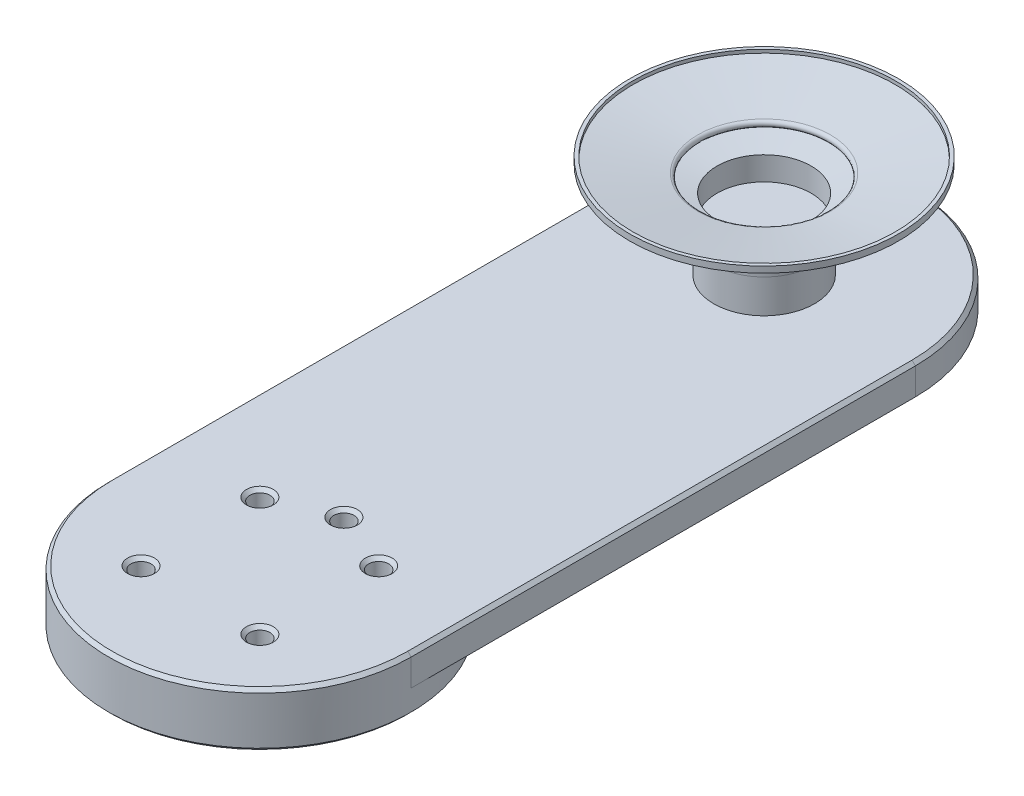
from build123d import *

# Parameters (mm, degrees)
SKIZZE2_R                       = 45
SKIZZE2_R_2                     = 31.5
AUFSATZ_LINEAR_AUSTRAGEN1_DEPTH = 6.2
SKIZZE3_R                       = 3
SKIZZE3_R_2                     = 6
AUFSATZ_LINEAR_AUSTRAGEN2_DEPTH = 10
SKIZZE4_R                       = 15
SKIZZE4_R_2                     = 6
AUFSATZ_LINEAR_AUSTRAGEN3_DEPTH = 10
SKIZZE5_R                       = 15
SKIZZE5_R_2                     = 6
AUFSATZ_LINEAR_AUSTRAGEN4_DEPTH = 3
VERRUNDUNG1_R                   = 1
FASE1_SIZE                      = 1


with BuildPart() as part:
    # Skizze2 → Aufsatz-Linear austragen1 (new body)
    with BuildSketch(Plane(origin=(0, 0, 0), x_dir=(1, 0, 0), z_dir=(0, 1, 0))):
        with Locations(Location((0, 0, 0), (0, 0, 90))):
            Circle(SKIZZE2_R)
        with Locations(Location((0, 0, 0), (0, 0, 90))):
            Circle(SKIZZE2_R_2, mode=Mode.SUBTRACT)
    extrude(amount=AUFSATZ_LINEAR_AUSTRAGEN1_DEPTH)

    # Skizze3 → Aufsatz-Linear austragen2 (add)
    with BuildSketch(Plane(origin=(0, 6.2, 0), x_dir=(1, 0, 0), z_dir=(0, 1, 0))):
        with BuildLine():
            Line((-45, 0), (-45, 150))
            ThreePointArc((-45, 150), (0, 195), (45, 150))
            Line((45, 150), (45, 0))
            ThreePointArc((45, 0), (0, -45), (-45, 0))
        make_face()
        with Locations(Location((0, 25, 0), (0, 0, 270))):
            Circle(SKIZZE3_R, mode=Mode.SUBTRACT)
        with Locations(Location((17.67766953, 17.67766953, 0), (0, 0, 270))):
            Circle(SKIZZE3_R, mode=Mode.SUBTRACT)
        with Locations(Location((17.67766953, -17.67766953, 0), (0, 0, 270))):
            Circle(SKIZZE3_R, mode=Mode.SUBTRACT)
        with Locations(Location((-17.67766953, -17.67766953, 0), (0, 0, 270))):
            Circle(SKIZZE3_R, mode=Mode.SUBTRACT)
        with Locations(Location((-17.67766953, 17.67766953, 0), (0, 0, 270))):
            Circle(SKIZZE3_R, mode=Mode.SUBTRACT)
        with Locations(Location((0, 150, 0), (0, 0, 270))):
            Circle(SKIZZE3_R_2, mode=Mode.SUBTRACT)
    extrude(amount=AUFSATZ_LINEAR_AUSTRAGEN2_DEPTH)

    # Fase1
    # the kernel refuses this chamfer: 1 mm, written as the material it takes off along each edge
    with BuildSketch(Plane(origin=(0, 16.2, 0), x_dir=(1, 0, 0), z_dir=(0, 0, -1))) as fase1_piece_1:
        Polygon((45, FASE1_SIZE), (45 - FASE1_SIZE, 0), (45, 0), align=None)
    revolve(axis=Axis((0, 16.2, 0), (0, -1, 0)), revolution_arc=180, mode=Mode.SUBTRACT)
    with BuildSketch(Plane(origin=(45, 16.2, -150), x_dir=(0.0274958766105891, -0.9996219169112968, 0), z_dir=(0, 0, 1)), Plane(origin=(-45, 16.2, 0), x_dir=(-0.0274958766105891, -0.9996219169112968, 0), z_dir=(0, 0, -1))) as fase1_piece_2:
        Polygon((FASE1_SIZE * 0.999621916911, -FASE1_SIZE * 0.0274958766106), (-FASE1_SIZE * 0.0274958766106, -FASE1_SIZE * 0.999621916911), (0, 0), align=None)
    extrude(amount=150, mode=Mode.SUBTRACT)
    with BuildSketch(Plane(origin=(0, 16.2, -150), x_dir=(-1, 0, 0), z_dir=(0, 0, 1))) as fase1_piece_3:
        Polygon((45, FASE1_SIZE), (45 - FASE1_SIZE, 0), (45, 0), align=None)
    revolve(axis=Axis((0, 16.2, -150), (0, -1, 0)), revolution_arc=180, mode=Mode.SUBTRACT)
    with BuildSketch(Plane(origin=(0, 6.2, -25), x_dir=(0, 0, 1), z_dir=(-1, 0, 0))) as fase1_piece_4:
        Polygon((3 + FASE1_SIZE, 0), (3, FASE1_SIZE), (3, 0), align=None)
    revolve(axis=Axis((0, 6.2, -25), (0, 1, 0)), mode=Mode.SUBTRACT)
    with BuildSketch(Plane(origin=(17.67766953, 6.2, -17.67766953), x_dir=(0, 0, 1), z_dir=(-1, 0, 0))) as fase1_piece_5:
        Polygon((3 + FASE1_SIZE, 0), (3, FASE1_SIZE), (3, 0), align=None)
    revolve(axis=Axis((17.67766953, 6.2, -17.67766953), (0, 1, 0)), mode=Mode.SUBTRACT)
    with BuildSketch(Plane(origin=(17.67766953, 6.2, 17.67766953), x_dir=(0, 0, 1), z_dir=(-1, 0, 0))) as fase1_piece_6:
        Polygon((3 + FASE1_SIZE, 0), (3, FASE1_SIZE), (3, 0), align=None)
    revolve(axis=Axis((17.67766953, 6.2, 17.67766953), (0, 1, 0)), mode=Mode.SUBTRACT)
    with BuildSketch(Plane(origin=(-17.67766953, 6.2, 17.67766953), x_dir=(0, 0, 1), z_dir=(-1, 0, 0))) as fase1_piece_7:
        Polygon((3 + FASE1_SIZE, 0), (3, FASE1_SIZE), (3, 0), align=None)
    revolve(axis=Axis((-17.67766953, 6.2, 17.67766953), (0, 1, 0)), mode=Mode.SUBTRACT)
    with BuildSketch(Plane(origin=(-17.67766953, 6.2, -17.67766953), x_dir=(0, 0, 1), z_dir=(-1, 0, 0))) as fase1_piece_8:
        Polygon((3 + FASE1_SIZE, 0), (3, FASE1_SIZE), (3, 0), align=None)
    revolve(axis=Axis((-17.67766953, 6.2, -17.67766953), (0, 1, 0)), mode=Mode.SUBTRACT)
    with BuildSketch(Plane(origin=(45, 6.2, -150), x_dir=(-0.9996219169112968, -0.027495876610586414, 0), z_dir=(0, 0, 1))) as fase1_piece_9_section:
        Polygon((FASE1_SIZE * 0.999621916911, -FASE1_SIZE * 0.0274958766106), (-FASE1_SIZE * 0.0274958766106, -FASE1_SIZE * 0.999621916911), (0, 0), align=None)
    fase1_piece_9 = extrude(amount=152.571682988, mode=Mode.PRIVATE)
    fase1_piece_9 = fase1_piece_9 - Plane(origin=(0, 6.532274543, 0), x_dir=(0, 0, -1), z_dir=(0, -1, 0)) * Cylinder(45, 310, mode=Mode.PRIVATE)
    add(fase1_piece_9, mode=Mode.SUBTRACT)
    with BuildSketch(Plane(origin=(0, 6.2, -150), x_dir=(-1, 0, 0), z_dir=(0, 0, 1))) as fase1_piece_10:
        Polygon((45 - FASE1_SIZE, 0), (45, -FASE1_SIZE), (45, 0), align=None)
    revolve(axis=Axis((0, 6.2, -150), (0, -1, 0)), revolution_arc=180, mode=Mode.SUBTRACT)
    with BuildSketch(Plane(origin=(-45, 6.2, 2.571682988), x_dir=(0.9996219169112968, -0.027495876610586414, 0), z_dir=(0, 0, -1))) as fase1_piece_11_section:
        Polygon((FASE1_SIZE * 0.999621916911, -FASE1_SIZE * 0.0274958766106), (-FASE1_SIZE * 0.0274958766106, -FASE1_SIZE * 0.999621916911), (0, 0), align=None)
    fase1_piece_11 = extrude(amount=152.571682988, mode=Mode.PRIVATE)
    fase1_piece_11 = fase1_piece_11 - Plane(origin=(0, 6.532274543, 0), x_dir=(0, 0, -1), z_dir=(0, -1, 0)) * Cylinder(45, 310, mode=Mode.PRIVATE)
    add(fase1_piece_11, mode=Mode.SUBTRACT)
    with BuildSketch(Plane(origin=(0, 16.2, -25), x_dir=(0, 0, 1), z_dir=(-1, 0, 0))) as fase1_piece_12:
        Polygon((3 + FASE1_SIZE, 0), (3, -FASE1_SIZE), (3, 0), align=None)
    revolve(axis=Axis((0, 16.2, -25), (0, 1, 0)), mode=Mode.SUBTRACT)
    with BuildSketch(Plane(origin=(17.67766953, 16.2, -17.67766953), x_dir=(0, 0, 1), z_dir=(-1, 0, 0))) as fase1_piece_13:
        Polygon((3 + FASE1_SIZE, 0), (3, -FASE1_SIZE), (3, 0), align=None)
    revolve(axis=Axis((17.67766953, 16.2, -17.67766953), (0, 1, 0)), mode=Mode.SUBTRACT)
    with BuildSketch(Plane(origin=(17.67766953, 16.2, 17.67766953), x_dir=(0, 0, 1), z_dir=(-1, 0, 0))) as fase1_piece_14:
        Polygon((3 + FASE1_SIZE, 0), (3, -FASE1_SIZE), (3, 0), align=None)
    revolve(axis=Axis((17.67766953, 16.2, 17.67766953), (0, 1, 0)), mode=Mode.SUBTRACT)
    with BuildSketch(Plane(origin=(-17.67766953, 16.2, 17.67766953), x_dir=(0, 0, 1), z_dir=(-1, 0, 0))) as fase1_piece_15:
        Polygon((3 + FASE1_SIZE, 0), (3, -FASE1_SIZE), (3, 0), align=None)
    revolve(axis=Axis((-17.67766953, 16.2, 17.67766953), (0, 1, 0)), mode=Mode.SUBTRACT)
    with BuildSketch(Plane(origin=(-17.67766953, 16.2, -17.67766953), x_dir=(0, 0, 1), z_dir=(-1, 0, 0))) as fase1_piece_16:
        Polygon((3 + FASE1_SIZE, 0), (3, -FASE1_SIZE), (3, 0), align=None)
    revolve(axis=Axis((-17.67766953, 16.2, -17.67766953), (0, 1, 0)), mode=Mode.SUBTRACT)
    with BuildSketch(Plane(origin=(0, 16.2, -150), x_dir=(0, 0, 1), z_dir=(-1, 0, 0))) as fase1_piece_17:
        Polygon((6, -FASE1_SIZE), (6 + FASE1_SIZE, 0), (6, 0), align=None)
    revolve(axis=Axis((0, 16.2, -150), (0, 1, 0)), mode=Mode.SUBTRACT)
    with BuildSketch(Plane(origin=(0, 0, 0), x_dir=(0, 0, -1), z_dir=(1, 0, 0))) as fase1_piece_18:
        Polygon((45, FASE1_SIZE), (45 - FASE1_SIZE, 0), (45, 0), align=None)
    revolve(axis=Axis((0, 0, 0), (0, 1, 0)), mode=Mode.SUBTRACT)
    with BuildSketch(Plane(origin=(0, 0, 0), x_dir=(0, 0, -1), z_dir=(1, 0, 0))) as fase1_piece_19:
        Polygon((31.5 + FASE1_SIZE, 0), (31.5, FASE1_SIZE), (31.5, 0), align=None)
    revolve(axis=Axis((0, 0, 0), (0, 1, 0)), mode=Mode.SUBTRACT)


with BuildPart() as body_2:
    # Skizze4 → Aufsatz-Linear austragen3 (new body)
    with BuildSketch(Plane(origin=(0, 16.2, 0), x_dir=(1, 0, 0), z_dir=(0, 1, 0))):
        with Locations(Location((0, 150, 0), (0, 0, 270))):
            Circle(SKIZZE4_R)
        with Locations(Location((0, 150, 0), (0, 0, 270))):
            Circle(SKIZZE4_R_2, mode=Mode.SUBTRACT)
    extrude(amount=AUFSATZ_LINEAR_AUSTRAGEN3_DEPTH)


with BuildPart() as body_3:
    # Skizze5 → Aufsatz-Linear austragen4 (new body)
    with BuildSketch(Plane(origin=(0, 26.2, 0), x_dir=(1, 0, 0), z_dir=(0, 1, 0))):
        with Locations(Location((0, 150, 0), (0, 0, 270))):
            Circle(SKIZZE5_R)
        with Locations(Location((0, 150, 0), (0, 0, 270))):
            Circle(SKIZZE5_R_2, mode=Mode.SUBTRACT)
    extrude(amount=AUFSATZ_LINEAR_AUSTRAGEN4_DEPTH)


with BuildPart() as body_4:
    # Skizze6 → Rotation1 (revolve)
    with BuildSketch(Plane(origin=(0, 0, -150), x_dir=(0, -1, 0), z_dir=(0, 0, 1)), mode=Mode.PRIVATE) as rotation1_sk:
        Polygon((-30.2, 0), (-30.2, 14), (-37.210031823, 14), (-39.303530015, 26.163095023), (-41.397028207, 14), (-45.7, 39), (-46.7, 39), (-46.7, 40), (-44.857414528, 40), (-41.397028207, 19.895369485), (-39.303530015, 32.058464508), (-36.367446351, 15), (-29.2, 15), (-29.2, 0), align=None)
    revolve(rotation1_sk.sketch.rotate(Axis((0, 29.2, -150), (0, -1, 0)), 90), axis=Axis((0, 29.2, -150), (0, -1, 0)))

    # Verrundung1
    verrundung1_edges = [body_4.edges().sort_by_distance(p)[0] for p in [
        (0, 39.303530015, -182.058464508),
        (0, 41.397028207, -164),
    ]]
    fillet(verrundung1_edges, radius=VERRUNDUNG1_R)


solid = Compound([part.part, body_2.part, body_3.part, body_4.part])
